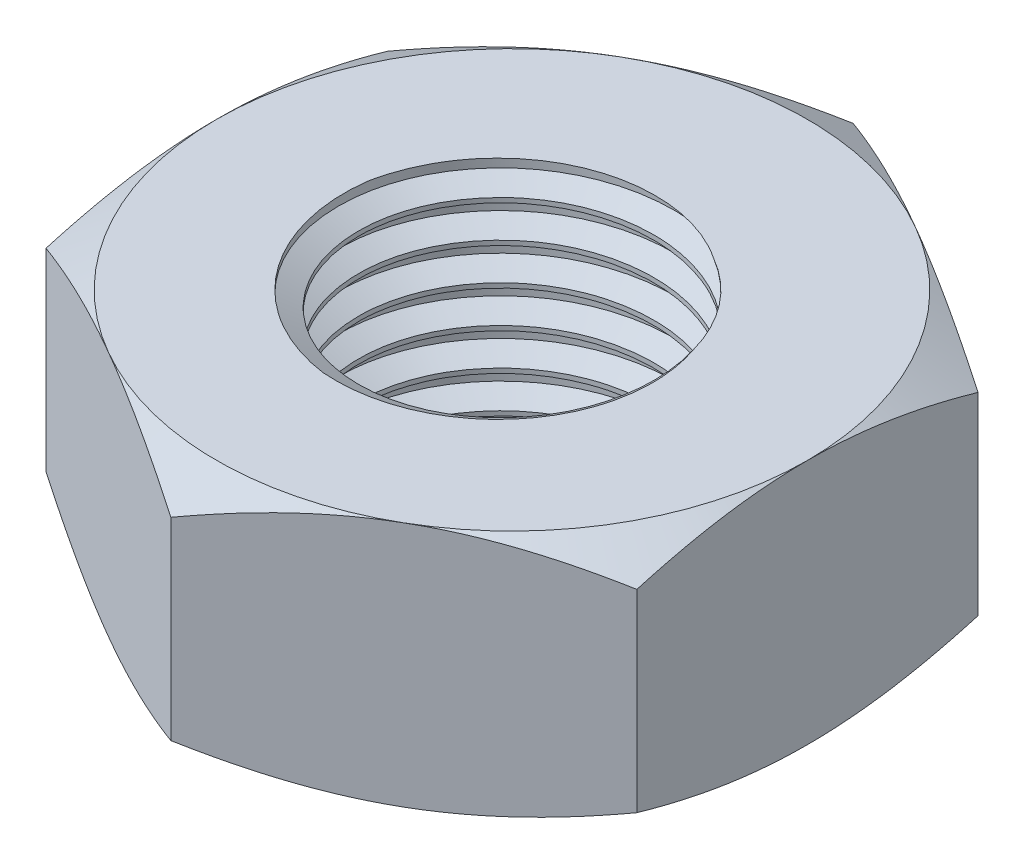
from build123d import *

# Parameters (mm, degrees)
SKETCH1_R                    = 6
BOSS_EXTRUDE1_DEPTH          = 5
SKETCH2_OUTSIDE_W            = 109.396
SKETCH2_OUTSIDE_H            = 113.108
SKETCH2_OUTSIDE_R            = 12
CUT_EXTRUDE1_DEPTH           = 21.880613018
CUT_EXTRUDE1_TAPER           = 60
CUT_EXTRUDE1_OTHER_WAY_DEPTH = 21.880613018
THREAD1_PITCH                = 1.5


with BuildPart() as part:
    # Sketch1 → Boss-Extrude1 (new, symmetric)
    with BuildSketch(Plane(origin=(0, 0, 0), x_dir=(1, 0, 0), z_dir=(0, 1, 0))):
        Polygon((0, 13.856406461), (-12, 6.92820323), (-12, -6.92820323), (0, -13.856406461), (12, -6.92820323), (12, 6.92820323), align=None)
        with Locations(Location((0, 0, 0), (0, 0, 270))):
            Circle(SKETCH1_R, mode=Mode.SUBTRACT)
    extrude(amount=BOSS_EXTRUDE1_DEPTH, both=True)

    # Sketch2 outside → Cut-Extrude1 (cut)
    with BuildSketch(Plane(origin=(0, 5, 0), x_dir=(1, 0, 0), z_dir=(0, 1, 0))):
        Rectangle(SKETCH2_OUTSIDE_W, SKETCH2_OUTSIDE_H)
        Circle(SKETCH2_OUTSIDE_R, mode=Mode.SUBTRACT)
    cut_extrude1 = extrude(amount=-CUT_EXTRUDE1_DEPTH, taper=CUT_EXTRUDE1_TAPER, mode=Mode.SUBTRACT)

    # Sketch2 outside → Cut-Extrude1 other way (cut)
    with BuildSketch(Plane(origin=(0, 5, 0), x_dir=(1, 0, 0), z_dir=(0, 1, 0))):
        Rectangle(SKETCH2_OUTSIDE_W, SKETCH2_OUTSIDE_H)
        Circle(SKETCH2_OUTSIDE_R, mode=Mode.SUBTRACT)
    extrude(amount=CUT_EXTRUDE1_OTHER_WAY_DEPTH, mode=Mode.SUBTRACT)

    # Mirror1: Cut-Extrude1 across plane
    add(cut_extrude1.mirror(Plane.ZX), mode=Mode.SUBTRACT)

    # Thread1: the profile of Thread Profile1 profile screwed along a right-hand helix of 18 turns, 8 arcs to a turn; built about Z, then put on its axis
    thread1_z = Axis((0, 0, 0), (0, 0, 1))
    thread1_corners = [(5.9997, 0, -0.000173205), (5.9997, 0, 1.312673201), (6.811898813, 0, 0.843749998), (6.811898813, 0, 0.468749998)]
    with BuildLine(mode=Mode.PRIVATE) as thread1_profile:
        Line(thread1_corners[0], thread1_corners[1])
        Line(thread1_corners[1], thread1_corners[2])
        Line(thread1_corners[2], thread1_corners[3])
        Line(thread1_corners[3], thread1_corners[0])
    thread1_cap = Face(thread1_profile.wire())
    thread1_turn_angles = [0, 22.5, 45, 67.5, 90, 112.5, 135, 157.5, 180, 202.5, 225, 247.5, 270, 292.5, 315, 337.5, 360]
    thread1_turn_weights = [1, 0.9238795325112867, 1, 0.9238795325112867, 1, 0.9238795325112867, 1, 0.9238795325112867, 1, 0.9238795325112867, 1, 0.9238795325112867, 1, 0.9238795325112867, 1, 0.9238795325112867, 1]
    thread1_turn_rails = [Edge.make_bspline([Vector(p[0], p[1], 0).rotate(thread1_z, thread1_turn_angles[k]) / thread1_turn_weights[k] + Vector(0, 0, p[2] + THREAD1_PITCH * thread1_turn_angles[k] / 360) for k in range(17)], [0, 0, 0, 1, 1, 2, 2, 3, 3, 4, 4, 5, 5, 6, 6, 7, 7, 8, 8, 8], 2, thread1_turn_weights) for p in thread1_corners]
    thread1_turn_sides = [Face.make_surface_from_curves(thread1_turn_rails[p[0]], thread1_turn_rails[p[1]]) for p in [(0, 1), (1, 2), (2, 3), (3, 0)]]
    thread1 = Plane(origin=(0, 10, 0), x_dir=(-1, 0, 0), z_dir=(0, -1, 0)) * Solid(Shell([*[p.moved(Location((0, 0, THREAD1_PITCH * i))) for i in range(18) for p in thread1_turn_sides], thread1_cap, thread1_cap.rotate(thread1_z, 6480).moved(Location((0, 0, THREAD1_PITCH * 6480 / 360)))]))
    add(thread1, mode=Mode.SUBTRACT)


solid = part.part
